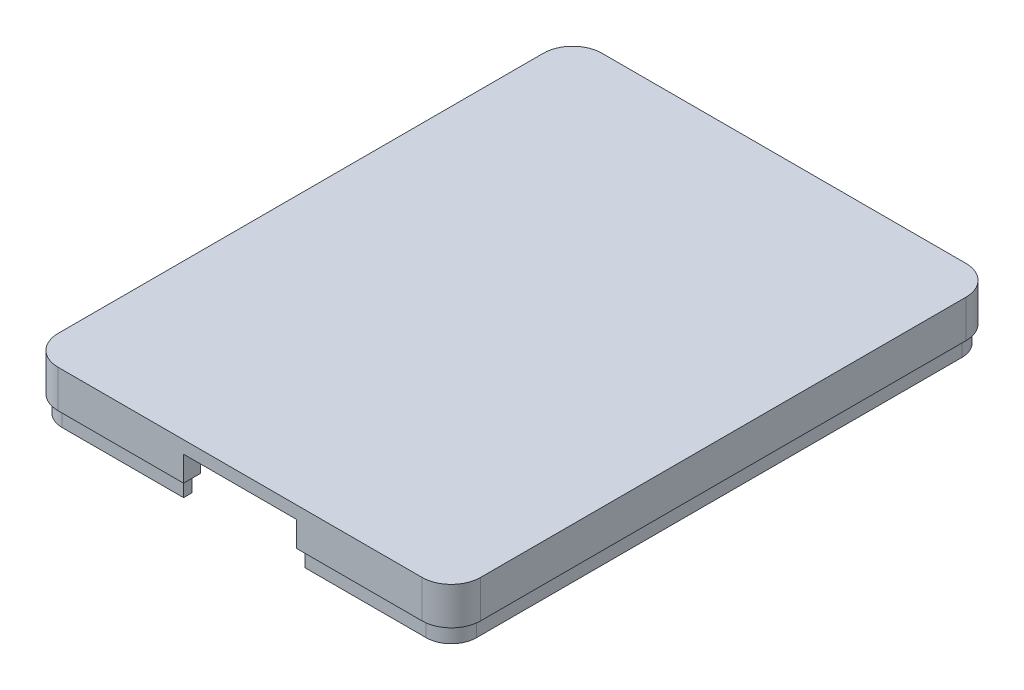
from build123d import *

# Parameters (mm, degrees)
BOSS_EXTRUDE1_DEPTH     = 4.5
CUT_EXTRUDE1_DEPTH      = 4
SKETCH3_W               = 13.5
SKETCH3_H               = 6
CUT_EXTRUDE2_DEPTH      = 15
SALIENTE_EXTRUIR1_DEPTH = 2


with BuildPart() as part:
    # Sketch1 → Boss-Extrude1 (new body)
    with BuildSketch(Plane(origin=(0, 0, 0), x_dir=(1, 0, 0), z_dir=(0, 1, 0))):
        with BuildLine():
            Line((-21.75, -32.5), (21.75, -32.5))
            ThreePointArc((21.75, -32.5), (24.224873734, -31.474873734), (25.25, -29))
            Line((25.25, -29), (25.25, 29))
            ThreePointArc((25.25, 29), (24.224873734, 31.474873734), (21.75, 32.5))
            Line((21.75, 32.5), (-21.75, 32.5))
            ThreePointArc((-21.75, 32.5), (-24.224873734, 31.474873734), (-25.25, 29))
            Line((-25.25, 29), (-25.25, -29))
            ThreePointArc((-25.25, -29), (-24.224873734, -31.474873734), (-21.75, -32.5))
        make_face()
    extrude(amount=BOSS_EXTRUDE1_DEPTH)

    # Sketch2 → Cut-Extrude1 (cut)
    with BuildSketch(Plane.XZ):
        with BuildLine():
            Line((-19.75, -30.5), (19.75, -30.5))
            ThreePointArc((19.75, -30.5), (22.224873734, -29.474873734), (23.25, -27))
            Line((23.25, -27), (23.25, 27))
            ThreePointArc((23.25, 27), (22.224873734, 29.474873734), (19.75, 30.5))
            Line((19.75, 30.5), (-19.75, 30.5))
            ThreePointArc((-19.75, 30.5), (-22.224873734, 29.474873734), (-23.25, 27))
            Line((-23.25, 27), (-23.25, -27))
            ThreePointArc((-23.25, -27), (-22.224873734, -29.474873734), (-19.75, -30.5))
        make_face()
    extrude(amount=-CUT_EXTRUDE1_DEPTH, mode=Mode.SUBTRACT)

    # Sketch3 → Cut-Extrude2 (cut)
    with BuildSketch(Plane.XY.offset(32.5)):
        Rectangle(SKETCH3_W, SKETCH3_H)
    extrude(amount=-CUT_EXTRUDE2_DEPTH, mode=Mode.SUBTRACT)

    # Croquis3 → Saliente-Extruir1 (add)
    with BuildSketch(Plane.XZ):
        with BuildLine():
            Line((-24.75, 29), (-24.75, -29))
            ThreePointArc((-24.75, -29), (-23.871320344, -31.121320344), (-21.75, -32))
            Line((-21.75, -32), (21.75, -32))
            ThreePointArc((21.75, -32), (23.871320344, -31.121320344), (24.75, -29))
            Line((24.75, -29), (24.75, 29))
            ThreePointArc((24.75, 29), (23.871320344, 31.121320344), (21.75, 32))
            Line((21.75, 32), (7.25, 32))
            Line((7.25, 32), (7.25, 31))
            Line((7.25, 31), (19.75, 31))
            ThreePointArc((19.75, 31), (22.578427125, 29.828427125), (23.75, 27))
            Line((23.75, 27), (23.75, -27))
            ThreePointArc((23.75, -27), (22.578427125, -29.828427125), (19.75, -31))
            Line((19.75, -31), (-19.75, -31))
            ThreePointArc((-19.75, -31), (-22.578427125, -29.828427125), (-23.75, -27))
            Line((-23.75, -27), (-23.75, 27))
            ThreePointArc((-23.75, 27), (-22.578427125, 29.828427125), (-19.75, 31))
            Line((-19.75, 31), (-7.25, 31))
            Line((-7.25, 31), (-7.25, 32))
            Line((-7.25, 32), (-21.75, 32))
            ThreePointArc((-21.75, 32), (-23.871320344, 31.121320344), (-24.75, 29))
        make_face()
    extrude(amount=SALIENTE_EXTRUIR1_DEPTH)


solid = part.part
